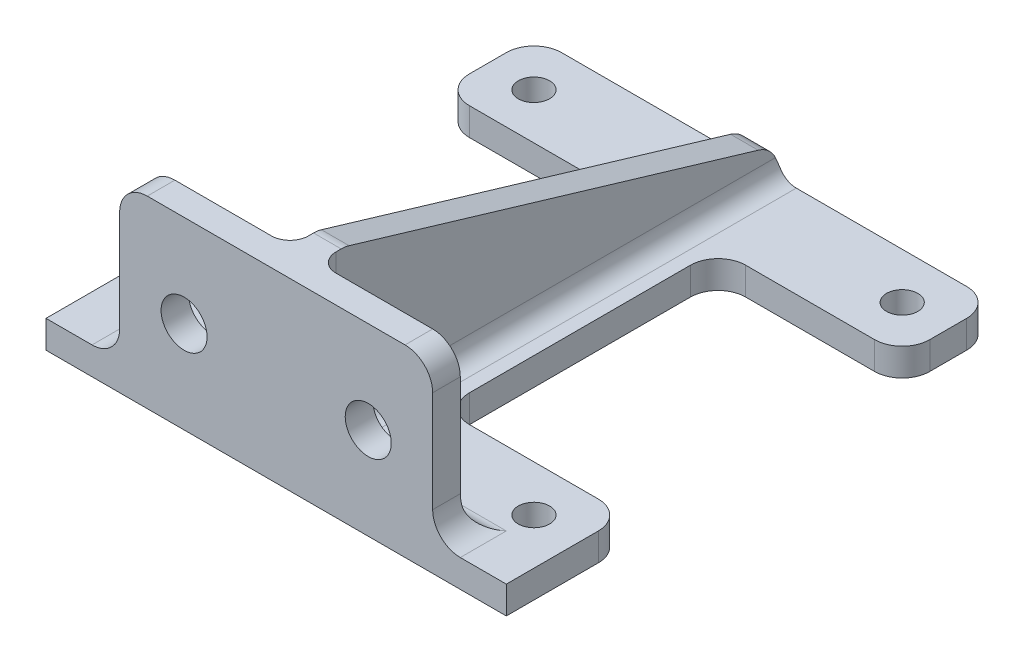
from build123d import *

# Parameters (mm, degrees)
ESQUISSE1_W             = 50
ESQUISSE1_H             = 50
ESQUISSE1_R             = 1.7
BOSS_EXTRU_1_DEPTH      = 3
ESQUISSE2_W             = 50
ESQUISSE2_H             = 20
ESQUISSE2_R             = 2.5
BOSS_EXTRU_2_DEPTH      = 3
BOSS_EXTRU_3_DEPTH      = 1.5
BOSS_EXTRU_3_DEPTH_BACK = 1.5
ESQUISSE5_W             = 8
ESQUISSE5_H             = 17
ENL_V_MAT_EXTRU_2_DEPTH = 10
CONG_1_R                = 3
CONG_2_R                = 3
CONG_3_R                = 2
ESQUISSE4_W             = 20
ESQUISSE4_H             = 30
ENL_V_MAT_EXTRU_1_DEPTH = 73.725511411
CONG_4_R                = 3


with BuildPart() as part:
    # Esquisse1 → Boss.-Extru.1 (new body)
    with BuildSketch(Plane(origin=(0, 0, 0), x_dir=(1, 0, 0), z_dir=(0, 1, 0))):
        with Locations((25, 25)):
            Rectangle(ESQUISSE1_W, ESQUISSE1_H)
        with Locations(Location((5, 5, 0), (0, 0, 270))):
            Circle(ESQUISSE1_R, mode=Mode.SUBTRACT)
        with Locations(Location((5, 45, 0), (0, 0, 90))):
            Circle(ESQUISSE1_R, mode=Mode.SUBTRACT)
        with Locations(Location((45, 45, 0), (0, 0, 270))):
            Circle(ESQUISSE1_R, mode=Mode.SUBTRACT)
        with Locations(Location((45, 5, 0), (0, 0, 90))):
            Circle(ESQUISSE1_R, mode=Mode.SUBTRACT)
    extrude(amount=BOSS_EXTRU_1_DEPTH)

    # Esquisse2 → Boss.-Extru.2 (add)
    with BuildSketch(Plane.XY):
        with Locations((25, 10)):
            Rectangle(ESQUISSE2_W, ESQUISSE2_H)
        with Locations((15, 10)):
            Circle(ESQUISSE2_R, mode=Mode.SUBTRACT)
        with Locations(Location((35, 10, 0), (0, 0, 180))):
            Circle(ESQUISSE2_R, mode=Mode.SUBTRACT)
    extrude(amount=BOSS_EXTRU_2_DEPTH)

    # Esquisse3 → Boss.-Extru.3 (add, two sides: drawn at the far end of the back side and taken through both)
    with BuildSketch(Plane(origin=(25, 0, 0), x_dir=(0, 0, -1), z_dir=(1, 0, 0)).offset(-BOSS_EXTRU_3_DEPTH_BACK)):
        Polygon((0, 20), (3, 20), (50, 6), (50, 3), (0, 3), align=None)
    extrude(amount=BOSS_EXTRU_3_DEPTH + BOSS_EXTRU_3_DEPTH_BACK)

    # Esquisse5 → Enlèv. mat.-Extru.2 (cut)
    with BuildSketch(Plane(origin=(0, 0, 0), x_dir=(-1, 0, 0), z_dir=(0, 0, -1))):
        with Locations((-4, 11.5)):
            Rectangle(ESQUISSE5_W, ESQUISSE5_H)
        with Locations((-46, 11.5)):
            Rectangle(ESQUISSE5_W, ESQUISSE5_H)
    extrude(amount=-ENL_V_MAT_EXTRU_2_DEPTH, mode=Mode.SUBTRACT)

    # Congé1
    cong_1_edges = [part.edges().sort_by_distance(p)[0] for p in [
        (0, 1.5, -50),
        (50, 1.5, -50),
    ]]
    fillet(cong_1_edges, radius=CONG_1_R)

    # Congé2
    cong_2_edges = [part.edges().sort_by_distance(p)[0] for p in [
        (25, 20, -3),
        (25, 6, -50),
        (42, 20, 1.5),
        (8, 20, 1.5),
        (8, 3, 1.5),
        (42, 3, 1.5),
    ]]
    fillet(cong_2_edges, radius=CONG_2_R)

    # Congé3
    cong_3_edges = [part.edges().sort_by_distance(p)[0] for p in [
        (26.5, 11.5, 0),
    ]]
    fillet(cong_3_edges, radius=CONG_3_R)
    cong_3_2_edges = [part.edges().sort_by_distance(p)[0] for p in [
        (36.75, 3, 0),
    ]]
    fillet(cong_3_2_edges, radius=CONG_3_R)
    cong_3_3_edges = [part.edges().sort_by_distance(p)[0] for p in [
        (23.5, 11.5, 0),
    ]]
    fillet(cong_3_3_edges, radius=CONG_3_R)
    cong_3_4_edges = [part.edges().sort_by_distance(p)[0] for p in [
        (23.5, 3, -26),
    ]]
    fillet(cong_3_4_edges, radius=CONG_3_R)

    # Esquisse4 → Enlèv. mat.-Extru.1 (cut, through all)
    with BuildSketch(Plane(origin=(0, 3, 0), x_dir=(1, 0, 0), z_dir=(0, 1, 0))):
        with Locations((40, 25)):
            Rectangle(ESQUISSE4_W, ESQUISSE4_H)
        with Locations((10, 25)):
            Rectangle(ESQUISSE4_W, ESQUISSE4_H)
    extrude(amount=-ENL_V_MAT_EXTRU_1_DEPTH, mode=Mode.SUBTRACT)

    # Congé4
    cong_4_edges = [part.edges().sort_by_distance(p)[0] for p in [
        (50, 1.5, -40),
        (50, 1.5, -10),
        (30, 1.5, -10),
        (30, 1.5, -40),
        (20, 1.5, -10),
        (0, 1.5, -10),
        (0, 1.5, -40),
        (20, 1.5, -40),
    ]]
    fillet(cong_4_edges, radius=CONG_4_R)


solid = part.part
